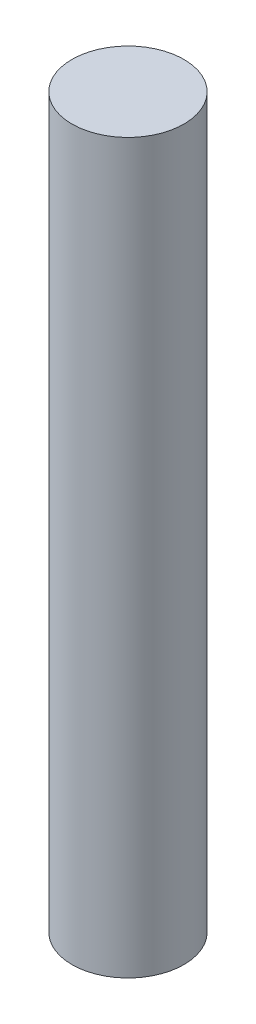
from build123d import *

# Parameters (mm, degrees)
SKETCH_1_R             = 5
EXTRUDE_1_DEPTH        = 65
HOLE_WIZARD_M4_1_D     = 3.3
HOLE_WIZARD_M4_1_DEPTH = 15
HOLE_WIZARD_M4_1_TIP   = 0.991420021


with BuildPart() as part:
    # 草图1 → 凸台-拉伸1 (new body)
    with BuildSketch(Plane(origin=(0, 0, 0), x_dir=(1, 0, 0), z_dir=(0, 1, 0))):
        Circle(SKETCH_1_R)
    extrude(amount=EXTRUDE_1_DEPTH)

    # M4 螺纹孔1
    with Locations(Plane(origin=(0, 0, 0), x_dir=(-1, 0, 0), z_dir=(0, -1, 0))):
        with Locations((0, 0)):
            Hole(HOLE_WIZARD_M4_1_D / 2, depth=HOLE_WIZARD_M4_1_DEPTH)
            with Locations((0, 0, -(HOLE_WIZARD_M4_1_DEPTH + HOLE_WIZARD_M4_1_TIP / 2))):  # 118° drill point
                Cone(0, HOLE_WIZARD_M4_1_D / 2, HOLE_WIZARD_M4_1_TIP, mode=Mode.SUBTRACT)


solid = part.part
